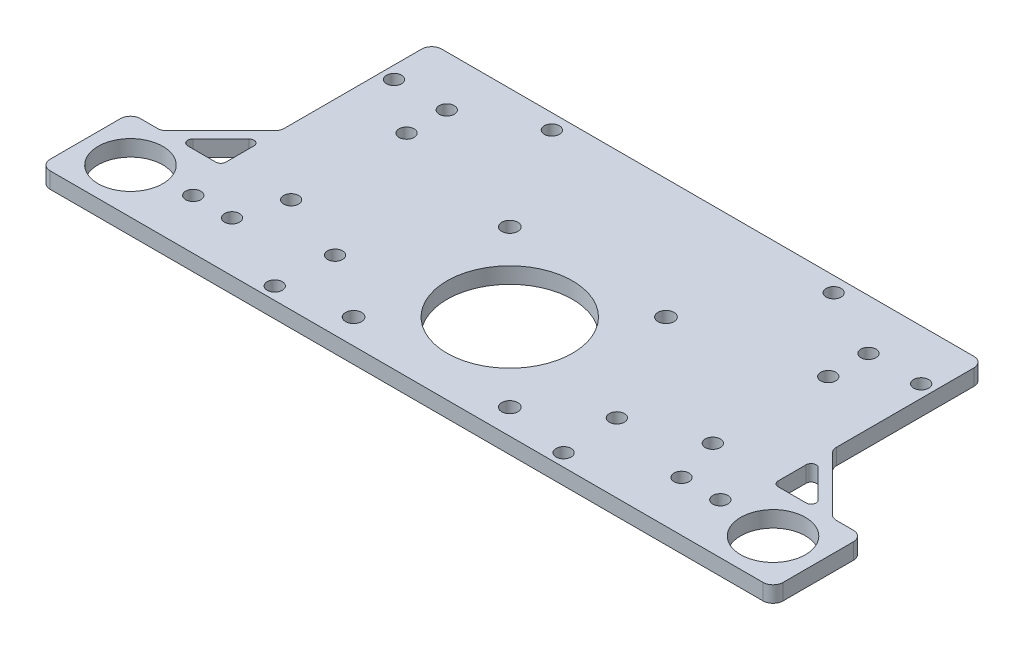
from build123d import *

# Parameters (mm, degrees)
EXTRUDE_1_DEPTH     = 3.2
SKETCH_2_R          = 12.5
SKETCH_2_R_2        = 1.6
SKETCH_2_R_3        = 1.5
SKETCH_2_R_4        = 6.45
CUT_EXTRUDE_1_DEPTH = 3.2
FILLET_1_R          = 2
FILLET_2_R          = 1


# Read off the part's stored shape, not the designer's step: 凸台-拉伸1
with BuildPart() as part:
    # 凸台-拉伸1 outline → 凸台-拉伸1 (new body)
    with BuildSketch(Plane(origin=(0, 0, 0), x_dir=(1, 0, 0), z_dir=(0, 1, 0))):
        Polygon((-55, -0.171572875), (-66.828427125, -12), (-73, -12), (-73, -30), (73, -30), (73, -12), (66.828427125, -12), (55, -0.171572875), (55, 30), (-55, 30), align=None)
        Polygon((-64, -12), (-55, -3), (-55, -12), align=None, mode=Mode.SUBTRACT)
        Polygon((55, -12), (55, -3), (64, -12), align=None, mode=Mode.SUBTRACT)
    extrude(amount=EXTRUDE_1_DEPTH)

    # 草图2 → 切除-拉伸1 (cut)
    with BuildSketch(Plane(origin=(0, 3.2, 0), x_dir=(1, 0, 0), z_dir=(0, 1, 0))):
        with Locations(Location((0, -9.443650814, 0), (0, 0, 270))):
            Circle(SKETCH_2_R)
        with Locations(Location((15.556349186, -25, 0), (0, 0, 270))):
            Circle(SKETCH_2_R_2)
        with Locations(Location((15.556349186, 6.112698372, 0), (0, 0, 270))):
            Circle(SKETCH_2_R_2)
        with Locations(Location((-15.556349186, 6.112698372, 0), (0, 0, 270))):
            Circle(SKETCH_2_R_2)
        with Locations(Location((-15.556349186, -25, 0), (0, 0, 270))):
            Circle(SKETCH_2_R_2)
        with Locations(Location((-52.5, 20, 0), (0, 0, 270))):
            Circle(SKETCH_2_R_3)
        with Locations(Location((-52.5, -20, 0), (0, 0, 270))):
            Circle(SKETCH_2_R_3)
        with Locations(Location((52.5, -20, 0), (0, 0, 270))):
            Circle(SKETCH_2_R_3)
        with Locations(Location((52.5, 20, 0), (0, 0, 270))):
            Circle(SKETCH_2_R_3)
        with Locations(Location((-64, -21, 0), (0, 0, 270))):
            Circle(SKETCH_2_R_4)
        with Locations(Location((64, -21, 0), (0, 0, 270))):
            Circle(SKETCH_2_R_4)
        with Locations(Location((42, 20, 0), (0, 0, 270))):
            Circle(SKETCH_2_R_3)
        with Locations(Location((42, 12, 0), (0, 0, 270))):
            Circle(SKETCH_2_R_3)
        with Locations(Location((-42, 12, 0), (0, 0, 270))):
            Circle(SKETCH_2_R_3)
        with Locations(Location((-42, 20, 0), (0, 0, 270))):
            Circle(SKETCH_2_R_3)
        with Locations(Location((42, -11, 0), (0, 0, 270))):
            Circle(SKETCH_2_R_3)
        with Locations(Location((-42, -11, 0), (0, 0, 270))):
            Circle(SKETCH_2_R_3)
        with Locations(Location((-28.065, 27, 0), (0, 0, 270))):
            Circle(SKETCH_2_R_3)
        with Locations(Location((28.065, 27, 0), (0, 0, 270))):
            Circle(SKETCH_2_R_3)
        with Locations(Location((-28.065, -16.18, 0), (0, 0, 270))):
            Circle(SKETCH_2_R_3)
        with Locations(Location((28.065, -16.18, 0), (0, 0, 270))):
            Circle(SKETCH_2_R_3)
        with Locations(Location((-28.769, -27.5, 0), (0, 0, 270))):
            Circle(SKETCH_2_R_3)
        with Locations(Location((28.769, -27.5, 0), (0, 0, 270))):
            Circle(SKETCH_2_R_3)
        with Locations(Location((-44.769, -20, 0), (0, 0, 270))):
            Circle(SKETCH_2_R_3)
        with Locations(Location((44.769, -20, 0), (0, 0, 270))):
            Circle(SKETCH_2_R_3)
    extrude(amount=-CUT_EXTRUDE_1_DEPTH, mode=Mode.SUBTRACT)

    # 圆角1
    fillet_1_edges = [part.edges().sort_by_distance(p)[0] for p in [
        (-66.828427125, 1.6, 12),
        (-55, 1.6, 0.171572875),
        (-55, 1.6, -30),
        (55, 1.6, -30),
        (55, 1.6, 0.171572875),
        (66.828427125, 1.6, 12),
        (73, 1.6, 12),
        (73, 1.6, 30),
        (-73, 1.6, 30),
        (-73, 1.6, 12),
    ]]
    fillet(fillet_1_edges, radius=FILLET_1_R)

    # 圆角2
    fillet_2_edges = [part.edges().sort_by_distance(p)[0] for p in [
        (-64, 1.6, 12),
        (-55, 1.6, 12),
        (-55, 1.6, 3),
        (55, 1.6, 3),
        (55, 1.6, 12),
        (64, 1.6, 12),
    ]]
    fillet(fillet_2_edges, radius=FILLET_2_R)


solid = part.part
